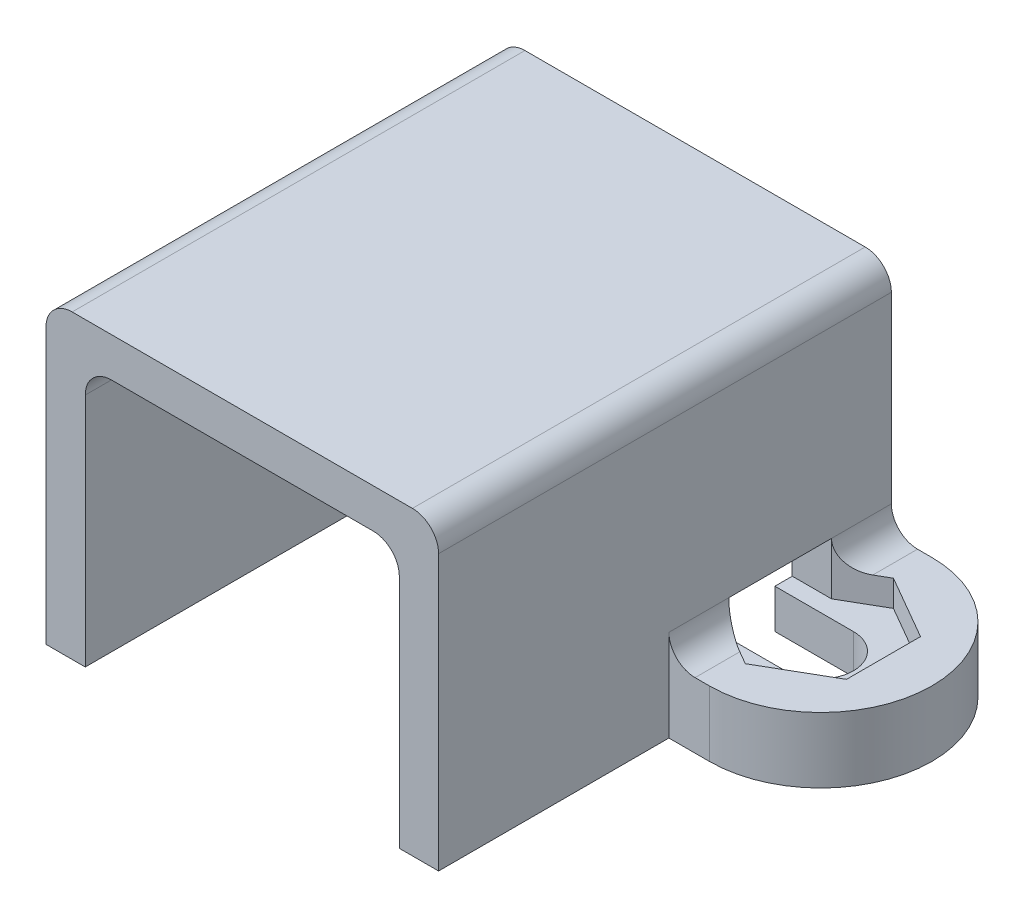
from build123d import *

# Parameters (mm, degrees)
BOSS_EXTRUDE1_DEPTH     = 17.3
BOSS_EXTRUDE2_DEPTH     = 2.5
CUT_EXTRUDE1_DEPTH      = 2.5
CUT_EXTRUDE2_DEPTH      = 1
CUT_EXTRUDE2_DEPTH_BACK = 1
FILLET1_R               = 1
FILLET2_R               = 1


with BuildPart() as part:
    # Sketch1 → Boss-Extrude1 (new body)
    with BuildSketch(Plane.XY):
        Polygon((6, 0), (7.5, 0), (7.5, 11.5), (-7.5, 11.5), (-7.5, 0), (-6, 0), (-6, 10), (6, 10), align=None)
    extrude(amount=BOSS_EXTRUDE1_DEPTH)

    # Sketch2 → Boss-Extrude2 (add)
    with BuildSketch(Plane.XZ):
        with BuildLine():
            Line((-7.5, 0), (-9.05, 0))
            ThreePointArc((-9.05, 0), (-13.3, 4.25), (-9.05, 8.5))
            Line((-9.05, 8.5), (-7.5, 8.5))
            Line((-7.5, 8.5), (-7.5, 0))
        make_face()
        with BuildLine():
            Line((7.5, 0), (9.05, 0))
            ThreePointArc((9.05, 0), (13.3, 4.25), (9.05, 8.5))
            Line((9.05, 8.5), (7.5, 8.5))
            Line((7.5, 8.5), (7.5, 0))
        make_face()
    extrude(amount=-BOSS_EXTRUDE2_DEPTH)

    # Sketch3 → Cut-Extrude1 (cut)
    with BuildSketch(Plane(origin=(0, 2.5, 0), x_dir=(1, 0, 0), z_dir=(0, 1, 0))):
        with BuildLine():
            Line((6, -2.95), (9, -2.95))
            ThreePointArc((9, -2.95), (10.3, -4.25), (9, -5.55))
            Line((9, -5.55), (6, -5.55))
            Line((6, -5.55), (6, -2.95))
        make_face()
        with BuildLine():
            Line((-6, -2.95), (-9, -2.95))
            ThreePointArc((-9, -2.95), (-10.3, -4.25), (-9, -5.55))
            Line((-9, -5.55), (-6, -5.55))
            Line((-6, -5.55), (-6, -2.95))
        make_face()
    extrude(amount=-CUT_EXTRUDE1_DEPTH, mode=Mode.SUBTRACT)

    # Sketch4 → Cut-Extrude2 (cut, two sides: drawn at the far end of the back side and taken through both)
    with BuildSketch(Plane(origin=(0, 2.5, 0), x_dir=(1, 0, 0), z_dir=(0, 1, 0)).offset(-CUT_EXTRUDE2_DEPTH_BACK)):
        Polygon((9, -1.420983681), (7.5, -2.287009085), (6, -2.287009085), (6, -6.212990915), (7.5, -6.212990915), (9, -7.079016319), (11.45, -5.66450816), (11.45, -2.83549184), align=None)
        Polygon((-6, -6.212990915), (-7.5, -6.212990915), (-9, -7.079016319), (-11.45, -5.66450816), (-11.45, -2.83549184), (-9, -1.420983681), (-7.5, -2.287009085), (-6, -2.287009085), align=None)
    extrude(amount=CUT_EXTRUDE2_DEPTH + CUT_EXTRUDE2_DEPTH_BACK, mode=Mode.SUBTRACT)

    # Fillet1
    fillet1_edges = [part.edges().sort_by_distance(p)[0] for p in [
        (6, 10, 8.65),
        (-6, 10, 8.65),
        (-7.5, 2.5, 1.143504542),
        (7.5, 2.5, 7.356495458),
        (7.5, 2.5, 1.143504542),
        (-7.5, 2.5, 7.356495458),
    ]]
    fillet(fillet1_edges, radius=FILLET1_R - 0.0001)  # a hair under: the kernel refuses the full size

    # Fillet2
    fillet2_edges = [part.edges().sort_by_distance(p)[0] for p in [
        (-7.5, 11.5, 8.65),
        (7.5, 11.5, 8.65),
    ]]
    fillet(fillet2_edges, radius=FILLET2_R)


solid = part.part
